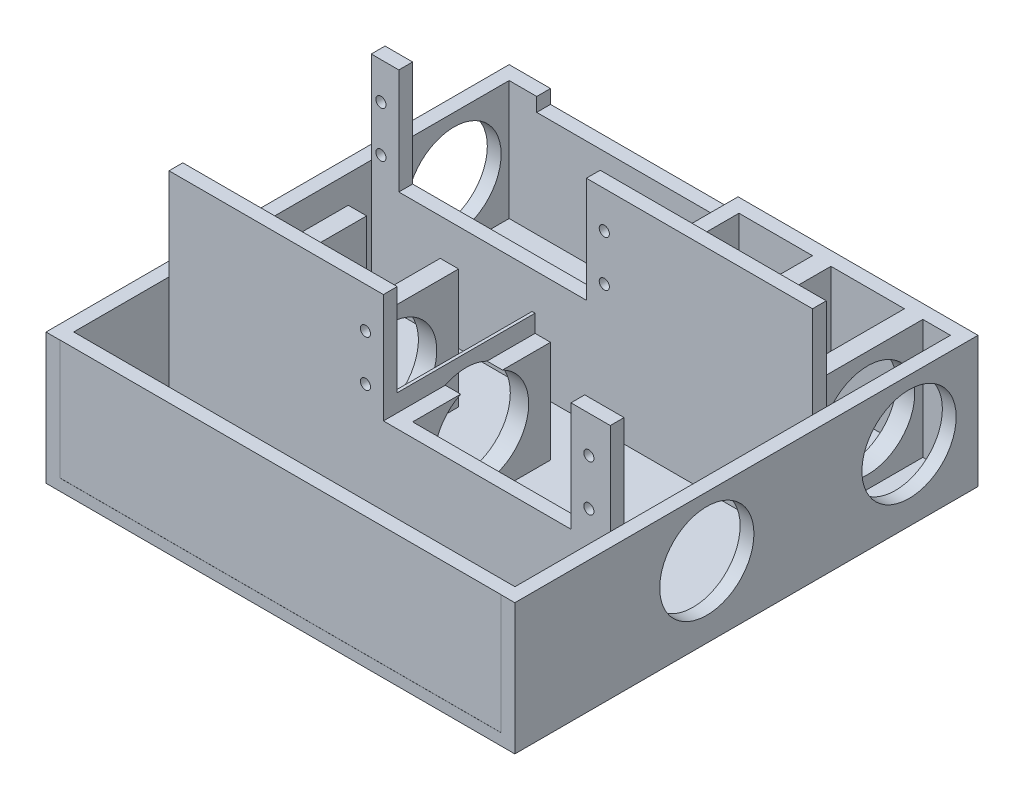
from build123d import *

# Parameters (mm, degrees)
SKETCH3_W           = 102
SKETCH3_H           = 136.761182254
BOSS_EXTRUDE2_DEPTH = 2.5
SKETCH4_W           = 4
SKETCH4_H           = 30
BOSS_EXTRUDE3_DEPTH = 26
SKETCH5_R           = 10.25
CUT_EXTRUDE1_DEPTH  = 150.415096196
SKETCH6_R           = 10.25
CUT_EXTRUDE2_DEPTH  = 168.823928483
SKETCH7_W           = 16
SKETCH7_H           = 3
BOSS_EXTRUDE5_DEPTH = 26
SKETCH8_R           = 1
CUT_EXTRUDE3_DEPTH  = 173.579317913
SKETCH9_R           = 10.25
CUT_EXTRUDE4_DEPTH  = 173.973613512
SKETCH10_W          = 96
SKETCH10_H          = 3
BOSS_EXTRUDE6_DEPTH = 46
SKETCH13_W          = 96
SKETCH13_H          = 3
BOSS_EXTRUDE7_DEPTH = 26
SKETCH14_W          = 102
SKETCH14_H          = 36
CUT_EXTRUDE7_DEPTH  = 178.369306734
CUT_EXTRUDE8_REACH  = 133.711
SKETCH15_W          = 40.8
SKETCH15_H          = 23
SKETCH15_R          = 1.103593158
CUT_EXTRUDE9_REACH  = 138.694
SKETCH16_W          = 40.8
SKETCH16_H          = 23.814429752
SKETCH16_R          = 1.103593158


with BuildPart() as part:
    # Sketch3 → Boss-Extrude2 (new body)
    with BuildSketch(Plane(origin=(0, 0, 0), x_dir=(1, 0, 0), z_dir=(0, 1, 0))):
        with Locations((-51, -68.380591127)):
            Rectangle(SKETCH3_W, SKETCH3_H)
    extrude(amount=BOSS_EXTRUDE2_DEPTH)

    # Sketch4 → Boss-Extrude3 (add)
    with BuildSketch(Plane(origin=(0, 2.5, 0), x_dir=(1, 0, 0), z_dir=(0, 1, 0))):
        with Locations((-31, -15)):
            Rectangle(SKETCH4_W, SKETCH4_H)
        with Locations((-51, -15)):
            Rectangle(SKETCH4_W, SKETCH4_H)
        with Locations((-11, -15)):
            Rectangle(SKETCH4_W, SKETCH4_H)
        with Locations((-71, -59)):
            Rectangle(SKETCH4_W, SKETCH4_H)
        with Locations((-91, -59)):
            Rectangle(SKETCH4_W, SKETCH4_H)
        with Locations((-51, -59)):
            Rectangle(SKETCH4_W, SKETCH4_H)
    extrude(amount=BOSS_EXTRUDE3_DEPTH)

    # Sketch5 → Cut-Extrude1 (cut, through all)
    with BuildSketch(Plane.ZY.offset(53)):
        with Locations((15, 15.5)):
            Circle(SKETCH5_R)
    extrude(amount=-CUT_EXTRUDE1_DEPTH, mode=Mode.SUBTRACT)

    # Sketch6 → Cut-Extrude2 (cut, through all)
    with BuildSketch(Plane.ZY.offset(93)):
        with Locations((59, 15.5)):
            Circle(SKETCH6_R)
    extrude(amount=-CUT_EXTRUDE2_DEPTH, mode=Mode.SUBTRACT)

    # Sketch7 → Boss-Extrude5 (add)
    with BuildSketch(Plane(origin=(0, 2.5, 0), x_dir=(1, 0, 0), z_dir=(0, 1, 0))):
        Polygon((-9, -3), (-3, -3), (-3, -133.761182254), (-99, -133.761182254), (-99, -3), (-53, -3), (-53, 0), (-102, 0), (-102, -136.761182254), (0, -136.761182254), (0, 0), (-9, 0), align=None)
        with Locations((-21, -1.5)):
            Rectangle(SKETCH7_W, SKETCH7_H)
        with Locations((-41, -1.5)):
            Rectangle(SKETCH7_W, SKETCH7_H)
    extrude(amount=BOSS_EXTRUDE5_DEPTH)

    # Sketch8 → Cut-Extrude3 (cut, through all)
    with BuildSketch(Plane(origin=(0, 2.5, 0), x_dir=(1, 0, 0), z_dir=(0, 1, 0))):
        with Locations((-67, -80)):
            Circle(SKETCH8_R)
        with Locations((-21.28, -80)):
            Circle(SKETCH8_R)
        with Locations((-21.28, -95.24)):
            Circle(SKETCH8_R)
        with Locations((-67, -95.24)):
            Circle(SKETCH8_R)
    extrude(amount=-CUT_EXTRUDE3_DEPTH, mode=Mode.SUBTRACT)

    # Sketch9 → Cut-Extrude4 (cut, through all)
    with BuildSketch(Plane(origin=(0, 0, 0), x_dir=(0, 0, -1), z_dir=(1, 0, 0))):
        with Locations((-15, 15.5)):
            Circle(SKETCH9_R)
        with Locations((-59, 15.5)):
            Circle(SKETCH9_R)
    extrude(amount=-CUT_EXTRUDE4_DEPTH, mode=Mode.SUBTRACT)

    # Sketch10 → Boss-Extrude6 (add)
    with BuildSketch(Plane(origin=(0, 2.5, 0), x_dir=(1, 0, 0), z_dir=(0, 1, 0))):
        with Locations((-51, -31.5)):
            Rectangle(SKETCH10_W, SKETCH10_H)
        with Locations((-51, -75.5)):
            Rectangle(SKETCH10_W, SKETCH10_H)
    extrude(amount=BOSS_EXTRUDE6_DEPTH)

    # Sketch13 → Boss-Extrude7 (add)
    with BuildSketch(Plane(origin=(0, 2.5, 0), x_dir=(1, 0, 0), z_dir=(0, 1, 0))):
        with Locations((-51, -99.24)):
            Rectangle(SKETCH13_W, SKETCH13_H)
    extrude(amount=BOSS_EXTRUDE7_DEPTH)

    # Sketch14 → Cut-Extrude7 (cut, through all)
    with BuildSketch(Plane.XZ):
        with Locations((-51, 118.761182254)):
            Rectangle(SKETCH14_W, SKETCH14_H)
    extrude(amount=-CUT_EXTRUDE7_DEPTH, mode=Mode.SUBTRACT)

    # Sketch15 → Cut-Extrude8 (cut, up to next)
    with BuildSketch(Plane.XY.offset(33), mode=Mode.PRIVATE) as cut_extrude8_sk1:
        with Locations((-72.6, 37)):
            Rectangle(SKETCH15_W, SKETCH15_H)
    cut_extrude8_tool1 = extrude(cut_extrude8_sk1.sketch, amount=-CUT_EXTRUDE8_REACH, mode=Mode.PRIVATE) & part.part
    # Sketch15 → Cut-Extrude8 (cut, up to next)
    with BuildSketch(Plane.XY.offset(33), mode=Mode.PRIVATE) as cut_extrude8_sk2:
        with Locations((-96.9, 30.5)):
            Circle(SKETCH15_R)
    cut_extrude8_tool2 = extrude(cut_extrude8_sk2.sketch, amount=-CUT_EXTRUDE8_REACH, mode=Mode.PRIVATE) & part.part
    # Sketch15 → Cut-Extrude8 (cut, up to next)
    with BuildSketch(Plane.XY.offset(33), mode=Mode.PRIVATE) as cut_extrude8_sk3:
        with Locations((-48.3, 30.5)):
            Circle(SKETCH15_R)
    cut_extrude8_tool3 = extrude(cut_extrude8_sk3.sketch, amount=-CUT_EXTRUDE8_REACH, mode=Mode.PRIVATE) & part.part
    # Sketch15 → Cut-Extrude8 (cut, up to next)
    with BuildSketch(Plane.XY.offset(33), mode=Mode.PRIVATE) as cut_extrude8_sk4:
        with Locations((-48.3, 40.5)):
            Circle(SKETCH15_R)
    cut_extrude8_tool4 = extrude(cut_extrude8_sk4.sketch, amount=-CUT_EXTRUDE8_REACH, mode=Mode.PRIVATE) & part.part
    # Sketch15 → Cut-Extrude8 (cut, up to next)
    with BuildSketch(Plane.XY.offset(33), mode=Mode.PRIVATE) as cut_extrude8_sk5:
        with Locations((-96.9, 40.5)):
            Circle(SKETCH15_R)
    cut_extrude8_tool5 = extrude(cut_extrude8_sk5.sketch, amount=-CUT_EXTRUDE8_REACH, mode=Mode.PRIVATE) & part.part
    add(cut_extrude8_tool1.solids().sort_by_distance((-72.6, 37, 33))[0], mode=Mode.SUBTRACT)
    add(cut_extrude8_tool2.solids().sort_by_distance((-96.9, 30.5, 33))[0], mode=Mode.SUBTRACT)
    add(cut_extrude8_tool3.solids().sort_by_distance((-48.3, 30.5, 33))[0], mode=Mode.SUBTRACT)
    add(cut_extrude8_tool4.solids().sort_by_distance((-48.3, 40.5, 33))[0], mode=Mode.SUBTRACT)
    add(cut_extrude8_tool5.solids().sort_by_distance((-96.9, 40.5, 33))[0], mode=Mode.SUBTRACT)

    # Sketch16 → Cut-Extrude9 (cut, up to next)
    with BuildSketch(Plane.XY.offset(77), mode=Mode.PRIVATE) as cut_extrude9_sk1:
        with Locations((-31.957922597, 36.592785124)):
            Rectangle(SKETCH16_W, SKETCH16_H)
    cut_extrude9_tool1 = extrude(cut_extrude9_sk1.sketch, amount=-CUT_EXTRUDE9_REACH, mode=Mode.PRIVATE) & part.part
    # Sketch16 → Cut-Extrude9 (cut, up to next)
    with BuildSketch(Plane.XY.offset(77), mode=Mode.PRIVATE) as cut_extrude9_sk2:
        with Locations((-56.257922597, 29.685570248)):
            Circle(SKETCH16_R)
    cut_extrude9_tool2 = extrude(cut_extrude9_sk2.sketch, amount=-CUT_EXTRUDE9_REACH, mode=Mode.PRIVATE) & part.part
    # Sketch16 → Cut-Extrude9 (cut, up to next)
    with BuildSketch(Plane.XY.offset(77), mode=Mode.PRIVATE) as cut_extrude9_sk3:
        with Locations((-7.657922597, 30.5)):
            Circle(SKETCH16_R)
    cut_extrude9_tool3 = extrude(cut_extrude9_sk3.sketch, amount=-CUT_EXTRUDE9_REACH, mode=Mode.PRIVATE) & part.part
    # Sketch16 → Cut-Extrude9 (cut, up to next)
    with BuildSketch(Plane.XY.offset(77), mode=Mode.PRIVATE) as cut_extrude9_sk4:
        with Locations((-7.657922597, 40.5)):
            Circle(SKETCH16_R)
    cut_extrude9_tool4 = extrude(cut_extrude9_sk4.sketch, amount=-CUT_EXTRUDE9_REACH, mode=Mode.PRIVATE) & part.part
    # Sketch16 → Cut-Extrude9 (cut, up to next)
    with BuildSketch(Plane.XY.offset(77), mode=Mode.PRIVATE) as cut_extrude9_sk5:
        with Locations((-56.257922597, 39.685570248)):
            Circle(SKETCH16_R)
    cut_extrude9_tool5 = extrude(cut_extrude9_sk5.sketch, amount=-CUT_EXTRUDE9_REACH, mode=Mode.PRIVATE) & part.part
    add(cut_extrude9_tool1.solids().sort_by_distance((-31.957923, 36.592785, 77))[0], mode=Mode.SUBTRACT)
    add(cut_extrude9_tool2.solids().sort_by_distance((-56.257923, 29.68557, 77))[0], mode=Mode.SUBTRACT)
    add(cut_extrude9_tool3.solids().sort_by_distance((-7.657923, 30.5, 77))[0], mode=Mode.SUBTRACT)
    add(cut_extrude9_tool4.solids().sort_by_distance((-7.657923, 40.5, 77))[0], mode=Mode.SUBTRACT)
    add(cut_extrude9_tool5.solids().sort_by_distance((-56.257923, 39.68557, 77))[0], mode=Mode.SUBTRACT)


solid = part.part
